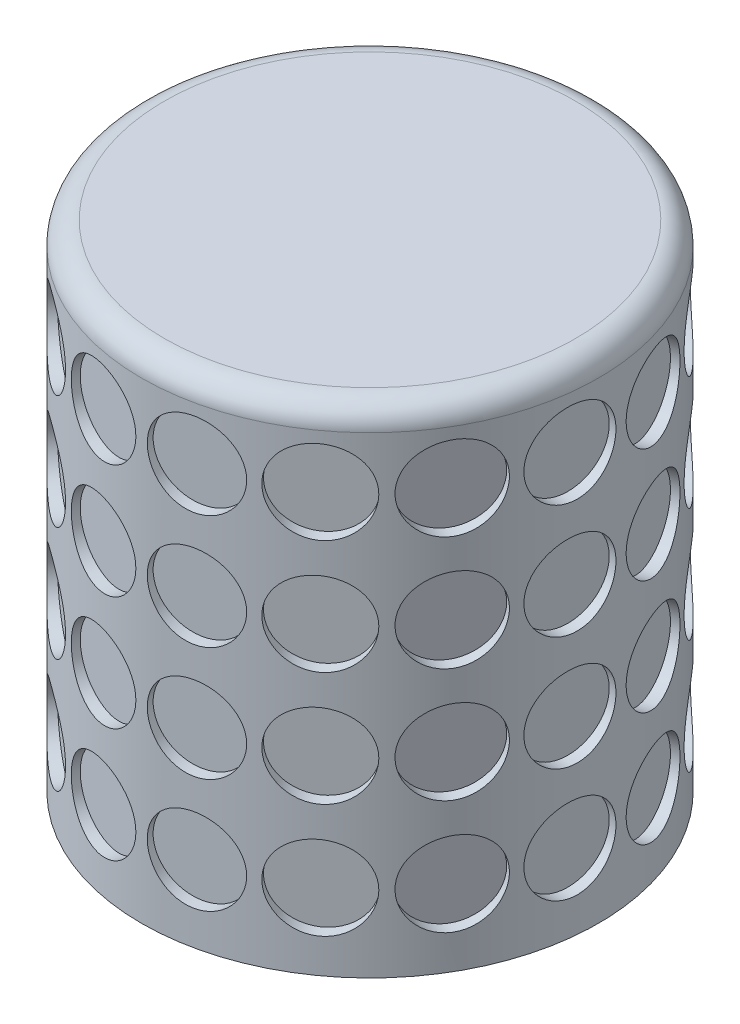
from build123d import *

# Parameters (mm, degrees)
CONG_1_R                     = 3
ESQUISSE4_R                  = 5.5
ENL_V_MAT_EXTRU_1_DEPTH      = 1.5
R_P_TITION_CIRCULAIRE1_COUNT = 15
ESQUISSE5_R                  = 6.5
ESQUISSE5_R_2                = 4.75
BOSS_EXTRU_1_DEPTH           = 20
CONG_2_R                     = 10


with BuildPart() as part:
    # Esquisse1 → Révolution1 (revolve)
    with BuildSketch(Plane(origin=(0, 0, 0), x_dir=(0, 1, 0), z_dir=(0, 0, 1))):
        Polygon((56.384615385, -5.5), (56.384615385, 24.5), (46.384615385, 24.5), (46.384615385, 2), (-8.615384615, 2), (-8.615384615, -5.5), align=None)
    revolve(axis=Axis((-24.5, 56.384615385, 0), (0, -1, 0)))

    # Congé1
    cong_1_edges = [part.edges().sort_by_distance(p)[0] for p in [
        (-54.5, 56.384615385, 0),
    ]]
    fillet(cong_1_edges, radius=CONG_1_R)

    # Esquisse4 → Enlèv. mat.-Extru.1 (cut)
    with BuildSketch(Plane(origin=(-24.5, 56.384615385, -30), x_dir=(-1, 0, 0), z_dir=(0, 0, -1))):
        with Locations((0, -10)):
            Circle(ESQUISSE4_R)
        with Locations((0, -25)):
            Circle(ESQUISSE4_R)
        with Locations((0, -40)):
            Circle(ESQUISSE4_R)
        with Locations((0, -55)):
            Circle(ESQUISSE4_R)
    enl_v_mat_extru_1 = extrude(amount=-ENL_V_MAT_EXTRU_1_DEPTH, mode=Mode.SUBTRACT)

    # Répétition circulaire1: Enlèv. mat.-Extru.1 ×15 about axis
    r_p_tition_circulaire1_axis = Axis((-24.5, 56.384615385, 0), (0, 1, 0))
    for i in range(1, R_P_TITION_CIRCULAIRE1_COUNT):
        add(enl_v_mat_extru_1.rotate(r_p_tition_circulaire1_axis, i * 360 / R_P_TITION_CIRCULAIRE1_COUNT), mode=Mode.SUBTRACT)

    # Esquisse5 → Boss.-Extru.1 (add)
    with BuildSketch(Plane.XZ.offset(-46.384615385)):
        with Locations((-24.5, 0)):
            Circle(ESQUISSE5_R)
        with Locations((-24.5, 0)):
            Circle(ESQUISSE5_R_2, mode=Mode.SUBTRACT)
    extrude(amount=BOSS_EXTRU_1_DEPTH)

    # Congé2
    cong_2_edges = [part.edges().sort_by_distance(p)[0] for p in [
        (-31, 46.384615385, 0),
    ]]
    fillet(cong_2_edges, radius=CONG_2_R)


solid = part.part
